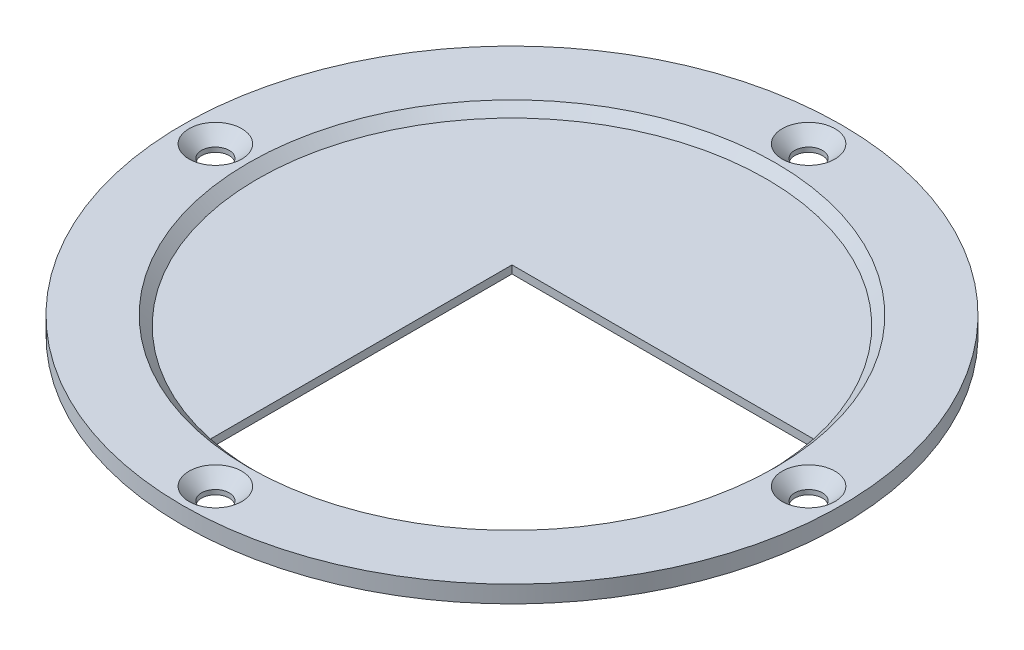
from build123d import *

# Parameters (mm, degrees)
SKETCH1_R           = 50
SKETCH1_R_2         = 2.1
BOSS_EXTRUDE1_DEPTH = 1.2
SKETCH2_R           = 50
SKETCH2_R_2         = 2.1
SKETCH2_R_3         = 40
BOSS_EXTRUDE2_DEPTH = 1.4
CHAMFER1_SIZE       = 1.4
CHAMFER2_SIZE       = 1.9


with BuildPart() as part:
    # Sketch1 → Boss-Extrude1 (new body)
    with BuildSketch(Plane(origin=(0, 0, 0), x_dir=(1, 0, 0), z_dir=(0, 1, 0))):
        with Locations(Location((0, 0, 0), (0, 0, 270))):
            Circle(SKETCH1_R)
        with Locations(Location((45, 0, 0), (0, 0, 270))):
            Circle(SKETCH1_R_2, mode=Mode.SUBTRACT)
        with Locations(Location((0, 45, 0), (0, 0, 270))):
            Circle(SKETCH1_R_2, mode=Mode.SUBTRACT)
        with Locations(Location((0, -45, 0), (0, 0, 90))):
            Circle(SKETCH1_R_2, mode=Mode.SUBTRACT)
        with Locations(Location((-45, 0, 0), (0, 0, 90))):
            Circle(SKETCH1_R_2, mode=Mode.SUBTRACT)
        with BuildLine():
            Line((-8, 0), (-8, 8))
            Line((-8, 8), (37.761885546, 8))
            ThreePointArc((37.761885546, 8), (27.294321754, -27.294321754), (-8, -37.761885546))
            Line((-8, -37.761885546), (-8, 0))
        make_face(mode=Mode.SUBTRACT)
    extrude(amount=BOSS_EXTRUDE1_DEPTH)

    # Sketch2 → Boss-Extrude2 (add)
    with BuildSketch(Plane(origin=(0, 1.2, 0), x_dir=(1, 0, 0), z_dir=(0, 1, 0))):
        with Locations(Location((0, 0, 0), (0, 0, 270))):
            Circle(SKETCH2_R)
        with Locations(Location((45, 0, 0), (0, 0, 270))):
            Circle(SKETCH2_R_2, mode=Mode.SUBTRACT)
        with Locations(Location((0, 45, 0), (0, 0, 270))):
            Circle(SKETCH2_R_2, mode=Mode.SUBTRACT)
        with Locations(Location((0, -45, 0), (0, 0, 90))):
            Circle(SKETCH2_R_2, mode=Mode.SUBTRACT)
        with Locations(Location((-45, 0, 0), (0, 0, 90))):
            Circle(SKETCH2_R_2, mode=Mode.SUBTRACT)
        with Locations(Location((0, 0, 0), (0, 0, 270))):
            Circle(SKETCH2_R_3, mode=Mode.SUBTRACT)
    extrude(amount=BOSS_EXTRUDE2_DEPTH)

    # Chamfer1
    chamfer1_edges = [part.edges().sort_by_distance(p)[0] for p in [
        (0, 1.2, -40),
    ]]
    chamfer(chamfer1_edges, length=CHAMFER1_SIZE - 0.0001)  # a hair under: the kernel refuses the full size

    # Chamfer2
    chamfer2_edges = [part.edges().sort_by_distance(p)[0] for p in [
        (45, 2.6, -2.1),
        (0, 2.6, -47.1),
        (0, 2.6, 47.1),
        (-45, 2.6, 2.1),
    ]]
    chamfer(chamfer2_edges, length=CHAMFER2_SIZE)


solid = part.part
